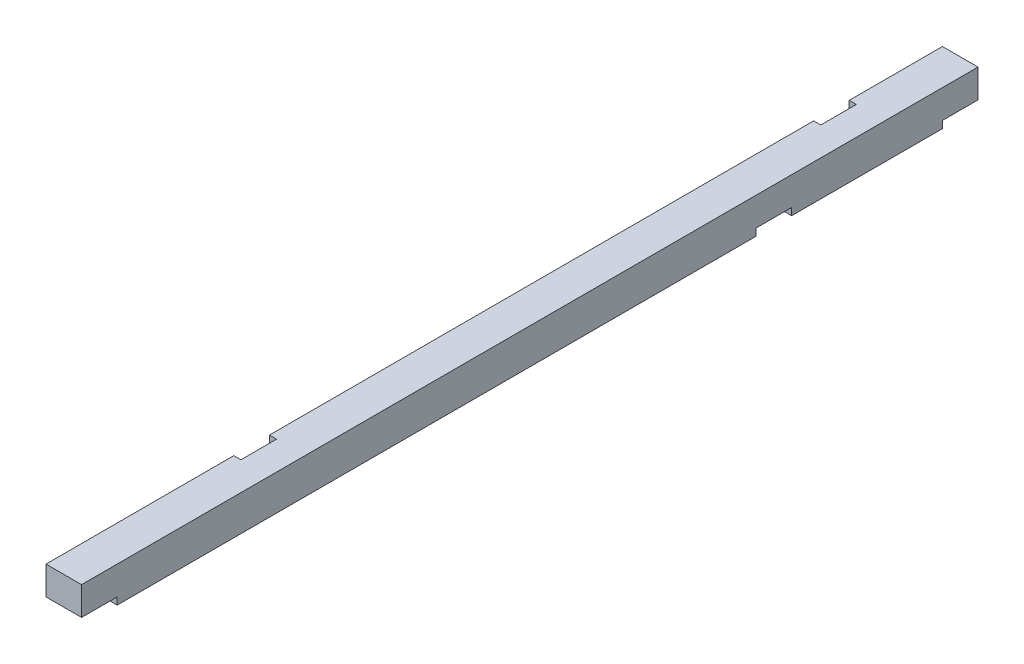
from build123d import *

# Parameters (mm, degrees)
ESQUISSE1_W             = 10
ESQUISSE1_H             = 10
BOSS_EXTRU_1_DEPTH      = 252
ESQUISSE2_W             = 10
ESQUISSE2_H             = 2
ENL_V_MAT_EXTRU_1_DEPTH = 253.247893946
ESQUISSE5_W             = 2
ESQUISSE5_H             = 10
ENL_V_MAT_EXTRU_4_DEPTH = 253.247893946


with BuildPart() as part:
    # Esquisse1 → Boss.-Extru.1 (new body)
    with BuildSketch(Plane.XY):
        Rectangle(ESQUISSE1_W, ESQUISSE1_H)
    extrude(amount=BOSS_EXTRU_1_DEPTH)

    # Esquisse2 → Enlèv. mat.-Extru.1 (cut, through all)
    with BuildSketch(Plane.ZY.offset(5)):
        with Locations((5, -4)):
            Rectangle(ESQUISSE2_W, ESQUISSE2_H)
        with Locations((57.4, -4)):
            Rectangle(ESQUISSE2_W, ESQUISSE2_H)
        with Locations((247, -4)):
            Rectangle(ESQUISSE2_W, ESQUISSE2_H)
    extrude(amount=-ENL_V_MAT_EXTRU_1_DEPTH, mode=Mode.SUBTRACT)

    # Esquisse5 → Enlèv. mat.-Extru.4 (cut, through all)
    with BuildSketch(Plane(origin=(0, 5, 0), x_dir=(1, 0, 0), z_dir=(0, 1, 0))):
        with Locations((-4, -194.2)):
            Rectangle(ESQUISSE5_W, ESQUISSE5_H)
        with Locations((-4, -31.2)):
            Rectangle(ESQUISSE5_W, ESQUISSE5_H)
    extrude(amount=-ENL_V_MAT_EXTRU_4_DEPTH, mode=Mode.SUBTRACT)


solid = part.part
